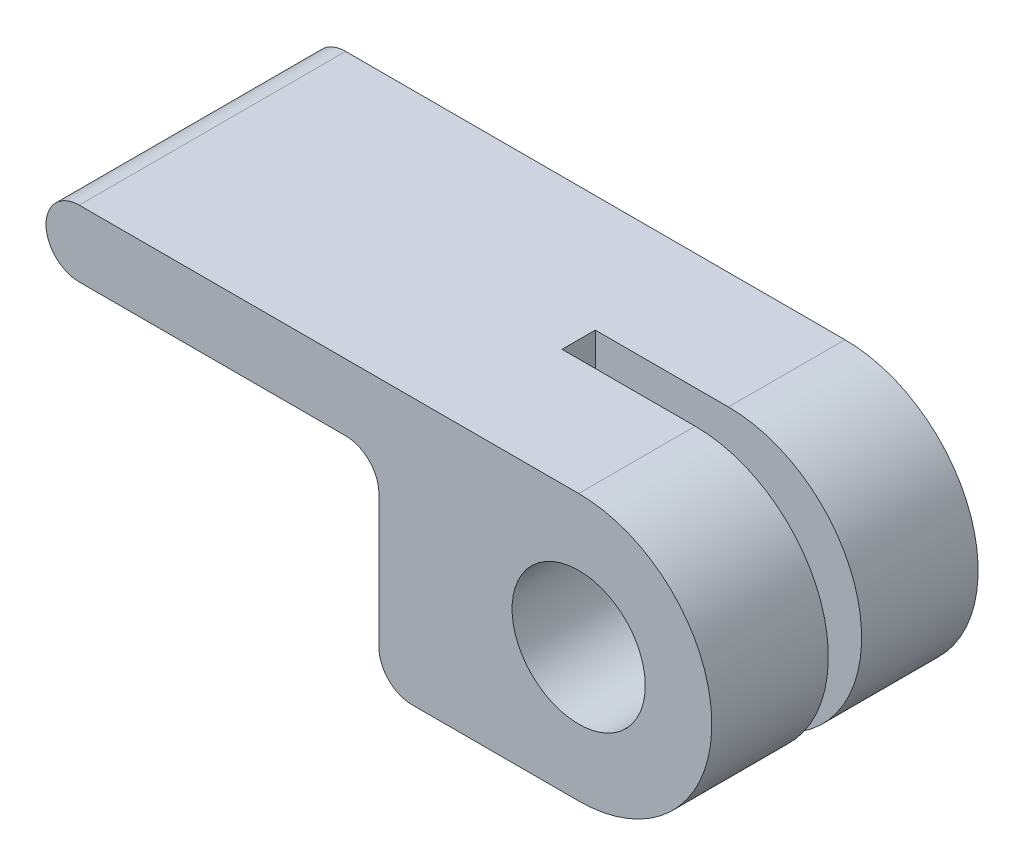
from build123d import *

# Parameters (mm, degrees)
SKETCH1_R           = 3.175
BOSS_EXTRUDE1_DEPTH = 12.7
CUT_EXTRUDE1_START  = -5.55625
SKETCH2_W           = 12.7
SKETCH2_H           = 12.7
CUT_EXTRUDE1_DEPTH  = 1.5875
FILLET1_R           = 1.5875


with BuildPart() as part:
    # Sketch1 → Boss-Extrude1 (new body)
    with BuildSketch(Plane.XY):
        with BuildLine():
            ThreePointArc((0, -6.35), (6.35, 0), (0, 6.35))
            Line((0, 6.35), (-25.4, 6.35))
            Line((-25.4, 6.35), (-25.4, 3.175))
            Line((-25.4, 3.175), (-9.525, 3.175))
            Line((-9.525, 3.175), (-9.525, -6.35))
            Line((-9.525, -6.35), (0, -6.35))
        make_face()
        Circle(SKETCH1_R, mode=Mode.SUBTRACT)
    extrude(amount=BOSS_EXTRUDE1_DEPTH)

    # Sketch2 → Cut-Extrude1 (cut)
    with BuildSketch(Plane.XY.offset(12.7).offset(CUT_EXTRUDE1_START)):
        Rectangle(SKETCH2_W, SKETCH2_H)
    extrude(amount=-CUT_EXTRUDE1_DEPTH, mode=Mode.SUBTRACT)

    # Fillet1
    fillet1_edges = [part.edges().sort_by_distance(p)[0] for p in [
        (-9.525, 3.175, 6.35),
        (-9.525, -6.35, 6.35),
        (-25.4, 6.35, 6.35),
        (-25.4, 3.175, 6.35),
    ]]
    fillet(fillet1_edges, radius=FILLET1_R - 0.0001)  # a hair under: the kernel refuses the full size


solid = part.part
